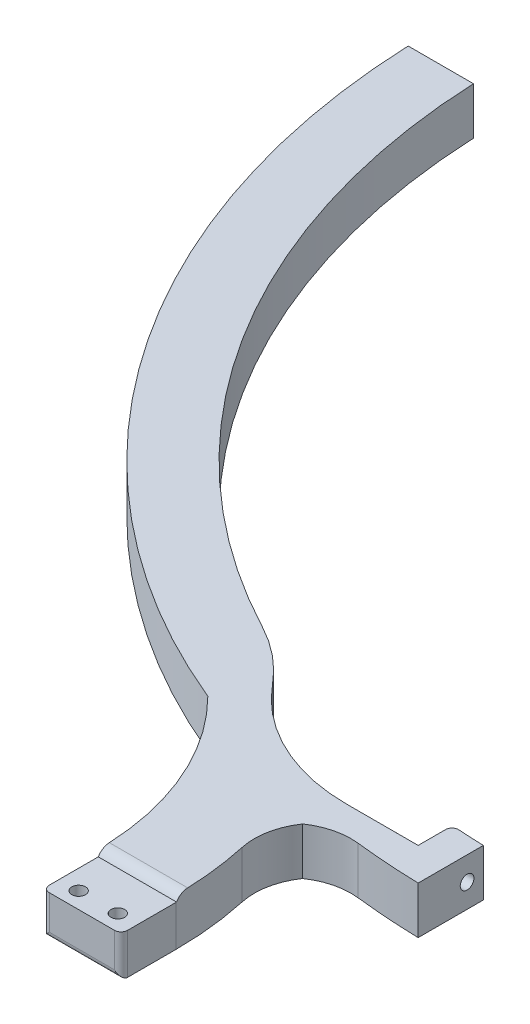
from build123d import *

# Parameters (mm, degrees)
BOSS_EXTRUDE1_DEPTH = 7.25
CUT_EXTRUDE2_DEPTH  = 2
SKETCH6_R           = 1.05
CUT_EXTRUDE3_DEPTH  = 184.988971882
FILLET1_R           = 1
CUT_EXTRUDE6_DEPTH  = 10
SKETCH14_R          = 1.05
CUT_EXTRUDE7_DEPTH  = 5
FILLET3_R           = 1
FILLET4_R           = 10
SKETCH16_W          = 40
SKETCH16_H          = 15
CUT_EXTRUDE8_DEPTH  = 1
FILLET5_R           = 2


with BuildPart() as part:
    # Sketch2 → Boss-Extrude1 (new body)
    with BuildSketch(Plane(origin=(0, 0, 0), x_dir=(1, 0, 0), z_dir=(0, 1, 0))):
        with BuildLine():
            Line((-17.623152329, -113.641649504), (-22.623152329, -118.641649504))
            ThreePointArc((-22.623152329, -118.641649504), (-20.659920019, -126.747167143), (-20, -135.060902938))
            Line((-20, -135.060902938), (-20, -143.510902938))
            Line((-20, -143.510902938), (-32, -143.510902938))
            Line((-32, -143.510902938), (-32, -135.060902938))
            ThreePointArc((-32, -135.060902938), (-35.097995018, -119.486230235), (-43.920338415, -106.282660267))
            ThreePointArc((-43.920338415, -106.282660267), (-94.299467161, -65.822568266), (-114.908659431, -4.582574373))
            Line((-114.908659431, -4.582574373), (-104.899952393, -4.582574373))
            ThreePointArc((-104.899952393, -4.582574373), (-73.684211281, -74.803990588), (-3, -104.957134107))
            Line((-3, -104.957134107), (-3, -114.960862906))
            ThreePointArc((-3, -114.960862906), (-10.332651354, -114.534869433), (-17.623152329, -113.641649504))
        make_face()
    extrude(amount=BOSS_EXTRUDE1_DEPTH)

    # Sketch4 → Cut-Extrude2 (cut)
    with BuildSketch(Plane(origin=(0, 0, 4.582574373), x_dir=(-1, 0, 0), z_dir=(0, 0, -1))):
        Polygon((111.556991832, 5.27912492), (109.29813467, 5.883330451), (107.64544875, 4.229205531), (108.251619992, 1.97087508), (110.510477153, 1.366669549), (112.163163073, 3.020794469), align=None)
    extrude(amount=-CUT_EXTRUDE2_DEPTH, mode=Mode.SUBTRACT)

    # Sketch6 → Cut-Extrude3 (cut, through all)
    with BuildSketch(Plane(origin=(0, 7.25, 0), x_dir=(1, 0, 0), z_dir=(0, 1, 0))):
        with Locations(Location((-29, -141.010902938, 0), (0, 0, 270))):
            Circle(SKETCH6_R)
        with Locations(Location((-23, -141.010902938, 0), (0, 0, 270))):
            Circle(SKETCH6_R)
    extrude(amount=-CUT_EXTRUDE3_DEPTH, mode=Mode.SUBTRACT)

    # Fillet1
    fillet1_edges = [part.edges().sort_by_distance(p)[0] for p in [
        (-26, 0, 143.510902938),
        (-20, 3.625, 143.510902938),
        (-32, 3.625, 143.510902938),
        (-26, 7.25, 143.510902938),
    ]]
    fillet(fillet1_edges, radius=FILLET1_R)

    # Sketch13 → Cut-Extrude6 (cut)
    with BuildSketch(Plane(origin=(0, 7.25, 0), x_dir=(1, 0, 0), z_dir=(0, 1, 0))):
        with BuildLine():
            Line((-8, -109.958998506), (-19, -109.958998506))
            ThreePointArc((-19, -109.958998506), (-30.884750495, -107.29264995), (-40.491380382, -99.804701556))
            ThreePointArc((-40.491380382, -99.804701556), (-44.399963721, -95.911179829), (-49, -92.86549413))
            Line((-49, -92.86549413), (-8, -92.86549413))
            Line((-8, -92.86549413), (-8, -109.958998506))
        make_face()
    extrude(amount=-CUT_EXTRUDE6_DEPTH, mode=Mode.SUBTRACT)

    # Sketch14 → Cut-Extrude7 (cut)
    with BuildSketch(Plane(origin=(-3, 0, 0), x_dir=(0, 0, -1), z_dir=(1, 0, 0))):
        with Locations((-107.458066307, 3.625)):
            Circle(SKETCH14_R)
    extrude(amount=-CUT_EXTRUDE7_DEPTH, mode=Mode.SUBTRACT)

    # Fillet3
    fillet3_edges = [part.edges().sort_by_distance(p)[0] for p in [
        (-8, 3.625, 104.694794522),
    ]]
    fillet(fillet3_edges, radius=FILLET3_R)

    # Fillet4
    # the kernel refuses this fillet: 10 mm, written as the material it adds along each edge
    with BuildSketch(Plane(origin=(-22.623152329, 0, 118.641649504), x_dir=(0.7071067811865469, 0, -0.7071067811865481), z_dir=(0, 1, 0))) as fillet4_piece_1:
        with BuildLine():
            CenterArc((5.789991957, -10), FILLET4_R, 90, 57.380097375)
            ThreePointArc((-2.632659996, -4.609366079), (-1.258256696, -2.337851865), (0, 0))
            Line((0, 0), (5.789991957, 0))
        make_face()
    extrude(amount=7.25)
    with BuildSketch(Plane(origin=(-17.623152329, 0, 113.641649504), x_dir=(0.9911373960250678, 0, 0.13284073998833376), z_dir=(0, 1, 0))) as fillet4_piece_2:
        with BuildLine():
            CenterArc((4.947598948, -9.997874884), FILLET4_R, 91.18123592, 51.452542901)
            Line((-3.000126671, -3.928801026), (0, 0))
            ThreePointArc((0, 0), (2.370724496, -0.024438834), (4.741448992, 0))
        make_face()
    extrude(amount=7.25)

    # Sketch16 → Cut-Extrude8 (cut)
    with BuildSketch(Plane(origin=(0, 7.25, 0), x_dir=(1, 0, 0), z_dir=(0, 1, 0))):
        with Locations((-25.357096051, -142.5)):
            Rectangle(SKETCH16_W, SKETCH16_H)
    extrude(amount=-CUT_EXTRUDE8_DEPTH, mode=Mode.SUBTRACT)

    # Fillet5
    # the kernel refuses this fillet: 2 mm, written as the material it takes off along each edge
    with BuildSketch(Plane(origin=(-15.669908173, 7.25, 135), x_dir=(0, 0, -1), z_dir=(-1, 0, 0))) as fillet5_piece_1:
        with BuildLine():
            CenterArc((1.732050808, 2), FILLET5_R, 210, 60)
            Line((0, 1), (-0.034641016, 0.98))
            ThreePointArc((-0.034641016, 0.98), (-0.04, 0.5), (-0.04, 0))
            Line((-0.04, 0), (0, -0.04))
            Line((0, -0.04), (1.732050808, -0.04))
            Line((1.732050808, -0.04), (1.732050808, 0))
        make_face()
    extrude(amount=20.660264414, mode=Mode.SUBTRACT)


solid = part.part
